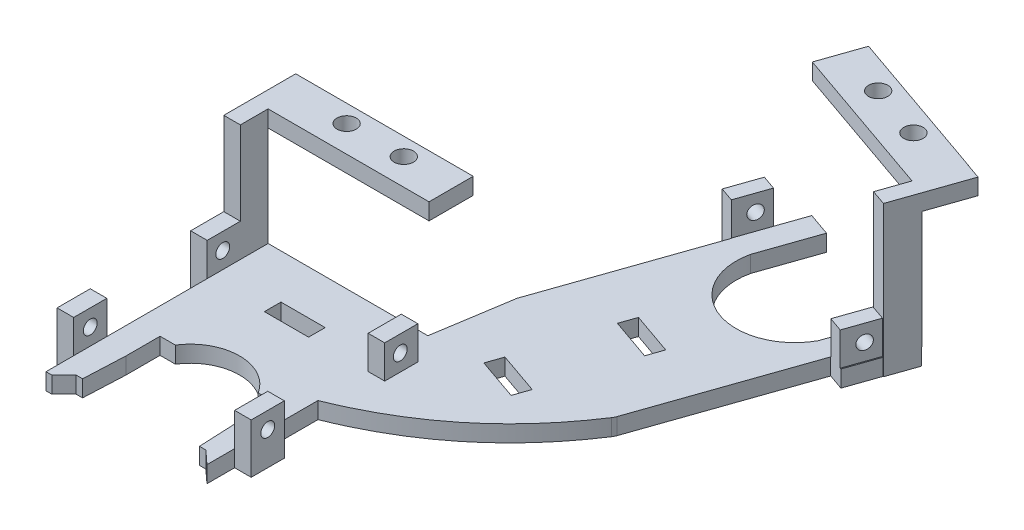
from build123d import *

# Parameters (mm, degrees)
SKETCH1_W                 = 29.13
SKETCH1_H                 = 40.2
BOSS_EXTRUDE1_DEPTH       = 3
SKETCH3_W                 = 6
SKETCH3_H                 = 3
BOSS_EXTRUDE2_DEPTH       = 3
SKETCH4_W                 = 3
SKETCH4_H                 = 6
BOSS_EXTRUDE3_DEPTH       = 6
SKETCH6_W                 = 6
SKETCH6_H                 = 3
BOSS_EXTRUDE4_DEPTH       = 5
SKETCH7_W                 = 3.000000005
SKETCH7_H                 = 6
BOSS_EXTRUDE6_DEPTH       = 6
SKETCH11_W                = 6
SKETCH11_H                = 3
BOSS_EXTRUDE7_DEPTH       = 3
SKETCH19_W                = 3
SKETCH19_H                = 6
BOSS_EXTRUDE11_DEPTH      = 6
SKETCH21_W                = 6
SKETCH21_H                = 3
BOSS_EXTRUDE12_DEPTH      = 3
SKETCH22_W                = 3
SKETCH22_H                = 6
BOSS_EXTRUDE13_DEPTH      = 6
CUT_EXTRUDE11_DEPTH       = 4
SKETCH30_W                = 25.92
SKETCH30_H                = 3
CUT_EXTRUDE12_DEPTH       = 15
SKETCH33_W                = 29.17650364
SKETCH33_H                = 3
BOSS_EXTRUDE14_DEPTH      = 40.3
SKETCH34_W                = 21.00258235
SKETCH34_H                = 3
CUT_EXTRUDE15_DEPTH       = 25
CUT_EXTRUDE16_DEPTH       = 5
SKETCH37_W                = 4.5
SKETCH37_H                = 3
SKETCH37_W_2              = 1.5
BOSS_EXTRUDE15_DEPTH      = 3
BOSS_EXTRUDE16_DEPTH      = 6
SKETCH41_W                = 6
SKETCH41_H                = 3
BOSS_EXTRUDE17_DEPTH      = 3
BOSS_EXTRUDE18_DEPTH      = 6
SKETCH46_W                = 5.02
SKETCH46_H                = 3
BOSS_EXTRUDE19_DEPTH      = 3
SKETCH48_W                = 3
SKETCH48_H                = 5.02
BOSS_EXTRUDE20_DEPTH      = 21.1
BOSS_EXTRUDE22_DEPTH      = 29.13
BOSS_EXTRUDE22_DEPTH_BACK = 3
SKETCH50_W                = 8
SKETCH50_H                = 3
SKETCH51_R                = 1.75
CUT_EXTRUDE21_DEPTH       = 5
SKETCH56_W                = 3.994197227
SKETCH56_H                = 3.994197227
CUT_EXTRUDE26_DEPTH       = 0.1
FILLET4_START             = -19
FILLET4_DEPTH             = 5
BOSS_EXTRUDE28_DEPTH      = 0.21
BOSS_EXTRUDE29_DEPTH      = 3
BOSS_EXTRUDE30_DEPTH      = 1.95
BOSS_EXTRUDE30_DEPTH_BACK = 4
SKETCH68_W                = 4.32399603
SKETCH68_H                = 3
SKETCH69_W                = 3.919724064
SKETCH69_H                = 3
BOSS_EXTRUDE31_DEPTH      = 1.83
SKETCH70_W                = 5.44243662
SKETCH70_H                = 3
BOSS_EXTRUDE32_DEPTH      = 3.1
BOSS_EXTRUDE33_DEPTH      = 24.17
SKETCH72_W                = 2.9
SKETCH72_H                = 2.93342148
BOSS_EXTRUDE34_DEPTH      = 8
SKETCH73_W                = 8
SKETCH73_H                = 2.93342148
BOSS_EXTRUDE35_DEPTH      = 29.3
SKETCH74_R                = 1.749999995
CUT_EXTRUDE27_DEPTH       = 5
CUT_EXTRUDE28_DEPTH       = 5
CUT_EXTRUDE28_DEPTH_BACK  = 5
SKETCH75_R                = 1.25
SKETCH75_R_2              = 1.249999999
CUT_EXTRUDE29_DEPTH       = 5
CUT_EXTRUDE29_DEPTH_BACK  = 5
SKETCH76_R                = 1.25
SKETCH77_R                = 1.25
CUT_EXTRUDE30_DEPTH       = 5
SKETCH78_R                = 1.25
CUT_EXTRUDE31_DEPTH       = 5
BOSS_EXTRUDE36_DEPTH      = 3
BOSS_EXTRUDE38_DEPTH      = 3
CUT_EXTRUDE32_DEPTH       = 10
CUT_EXTRUDE33_DEPTH       = 10
CUT_EXTRUDE34_DEPTH       = 10


with BuildPart() as part:
    # Sketch1 → Boss-Extrude1 (new body)
    with BuildSketch(Plane(origin=(0, 0, 0), x_dir=(1, 0, 0), z_dir=(0, 1, 0))):
        with Locations((-32.231128585, -983.966354464)):
            Rectangle(SKETCH1_W, SKETCH1_H)
        with BuildLine():
            Line((-15.507778999, -950.239071497), (-17.666128585, -963.866354464))
            Line((-17.666128585, -963.866354464), (-17.666128585, -983.966354464))
            add(Edge.make_bspline(
                [(11.825950039, -959.709415703), (1.028086592, -976.494542347), (-17.666128585, -983.966354464)],
                knots=[0, 0, 0, 1, 1, 1], degree=2))
            Line((11.825950039, -959.709415703), (-15.497121464, -950.208422428))
            Line((-15.497121464, -950.208422428), (-15.507778999, -950.239071497))
        make_face()
    extrude(amount=-BOSS_EXTRUDE1_DEPTH)

    # Sketch3 → Boss-Extrude2 (add)
    with BuildSketch(Plane.ZY.offset(46.796128585)):
        with Locations((971.886354464, -1.5)):
            Rectangle(SKETCH3_W, SKETCH3_H)
    extrude(amount=BOSS_EXTRUDE2_DEPTH)

    # Sketch4 → Boss-Extrude3 (add)
    with BuildSketch(Plane.XZ.offset(3)):
        with Locations((-48.296128585, 971.886354464)):
            Rectangle(SKETCH4_W, SKETCH4_H)
    extrude(amount=BOSS_EXTRUDE3_DEPTH)

    # Sketch6 → Boss-Extrude4 (add)
    with BuildSketch(Plane(origin=(-17.666128585, 0, 0), x_dir=(0, 0, -1), z_dir=(1, 0, 0))):
        with Locations((-971.886354464, -1.5)):
            Rectangle(SKETCH6_W, SKETCH6_H)
    extrude(amount=BOSS_EXTRUDE4_DEPTH)

    # Sketch7 → Boss-Extrude6 (add)
    with BuildSketch(Plane.XZ.offset(3)):
        with Locations((-16.166128583, 971.886354464)):
            Rectangle(SKETCH7_W, SKETCH7_H)
    extrude(amount=BOSS_EXTRUDE6_DEPTH)

    # Sketch11 → Boss-Extrude7 (add)
    with BuildSketch(Plane.ZY.offset(46.796128585)):
        with Locations((996.056354464, -1.5)):
            Rectangle(SKETCH11_W, SKETCH11_H)
    extrude(amount=BOSS_EXTRUDE7_DEPTH)

    # Sketch19 → Boss-Extrude11 (add)
    with BuildSketch(Plane.XZ.offset(3)):
        with Locations((-48.296128585, 996.056354464)):
            Rectangle(SKETCH19_W, SKETCH19_H)
    extrude(amount=BOSS_EXTRUDE11_DEPTH)

    # Sketch21 → Boss-Extrude12 (add)
    with BuildSketch(Plane(origin=(-17.666128585, 0, 0), x_dir=(0, 0, -1), z_dir=(1, 0, 0))):
        with Locations((-996.056354464, -1.5)):
            Rectangle(SKETCH21_W, SKETCH21_H)
    extrude(amount=BOSS_EXTRUDE12_DEPTH)

    # Sketch22 → Boss-Extrude13 (add)
    with BuildSketch(Plane.XZ.offset(3)):
        with Locations((-16.166128585, 996.056354464)):
            Rectangle(SKETCH22_W, SKETCH22_H)
    extrude(amount=BOSS_EXTRUDE13_DEPTH)

    # Sketch29 → Cut-Extrude11 (cut)
    with BuildSketch(Plane(origin=(0, 0, 0), x_dir=(1, 0, 0), z_dir=(0, 1, 0))):
        Polygon((-39.266128585, -988.183184315), (-42.032837695, -988.183184315), (-42.032837695, -994.347976596), (-42.376382193, -1001.868057312), (-43.532474114, -1001.868057312), (-45.730771266, -1004.066354464), (-39.266128585, -1004.066354464), align=None)
        Polygon((-24.371913352, -988.183184315), (-24.371913352, -1004.066354464), (-24.326128585, -1004.066354464), (-17.666128585, -1004.066354464), (-20.056128585, -1001.868057312), (-21.216128585, -1001.868057312), (-21.426128585, -997.305136389), (-21.556128585, -994.347976596), (-21.556128585, -988.183184315), align=None)
    extrude(amount=-CUT_EXTRUDE11_DEPTH, mode=Mode.SUBTRACT)

    # Sketch30 → Cut-Extrude12 (cut)
    with BuildSketch(Plane.ZY.offset(39.266128585)):
        with Locations((991.106354464, -1.5)):
            Rectangle(SKETCH30_W, SKETCH30_H)
    extrude(amount=-CUT_EXTRUDE12_DEPTH, mode=Mode.SUBTRACT)

    # Sketch33 → Boss-Extrude14 (add)
    with BuildSketch(Plane(origin=(-296.443416752, 0, 852.515567448), x_dir=(-0.9445255798324886, 0, -0.32843786176703366), z_dir=(0.3284378617670337, 0, -0.9445255798324887))):
        with Locations((-311.77524668, -1.5)):
            Rectangle(SKETCH33_W, SKETCH33_H)
    extrude(amount=BOSS_EXTRUDE14_DEPTH)

    # Sketch34 → Cut-Extrude15 (cut)
    with BuildSketch(Plane(origin=(-283.207370923, 0, 814.451186581), x_dir=(-0.9445255798324887, 0, -0.32843786176703327), z_dir=(0.32843786176703327, 0, -0.9445255798324887))):
        with Locations((-311.942483261, -1.5)):
            Rectangle(SKETCH34_W, SKETCH34_H)
    extrude(amount=-CUT_EXTRUDE15_DEPTH, mode=Mode.SUBTRACT)

    # Sketch35 → Cut-Extrude16 (cut)
    with BuildSketch(Plane(origin=(0, 0, 0), x_dir=(1, 0, 0), z_dir=(0, 1, 0))):
        Polygon((-6.699400727, -937.069026653), (11.67040627, -948.187810964), (13.138075545, -943.967069892), align=None)
    extrude(amount=-CUT_EXTRUDE16_DEPTH, mode=Mode.SUBTRACT)

    # Sketch37 → Boss-Extrude15 (add)
    with BuildSketch(Plane(origin=(280.946295288, 0, 97.69285498), x_dir=(-0.32843786176743117, 0, 0.9445255798323505), z_dir=(-0.9445255798323505, 0, -0.32843786176743117))):
        with Locations((868.136002588, -1.5)):
            Rectangle(SKETCH37_W, SKETCH37_H)
        with Locations((871.136002588, -1.5)):
            Rectangle(SKETCH37_W_2, SKETCH37_H)
    extrude(amount=BOSS_EXTRUDE15_DEPTH)

    # Sketch39 → Boss-Extrude16 (add)
    with BuildSketch(Plane.XZ.offset(3)):
        Polygon((-6.277028676, 914.559020058), (-3.745700122, 915.439233528), (-5.716327292, 921.106387007), (-8.247655846, 920.226173537), align=None)
    extrude(amount=BOSS_EXTRUDE16_DEPTH)

    # Sketch41 → Boss-Extrude17 (add)
    with BuildSketch(Plane(origin=(308.258672657, 0, 107.190129606), x_dir=(0.3284378617670337, 0, -0.9445255798324887), z_dir=(0.9445255798324887, 0, 0.3284378617670337))):
        with Locations((-868.898439213, -1.5)):
            Rectangle(SKETCH41_W, SKETCH41_H)
    extrude(amount=BOSS_EXTRUDE17_DEPTH)

    # Sketch42 → Boss-Extrude18 (add)
    with BuildSketch(Plane.XZ.offset(3)):
        Polygon((23.893176542, 925.063208116), (21.922549371, 930.730361595), (24.538885227, 931.640134472), (26.509512398, 925.972980993), align=None)
    extrude(amount=BOSS_EXTRUDE18_DEPTH)


with BuildPart() as body_2:
    # Mirror1: mirrored copy
    add(part.part.mirror(Plane(origin=(0, -9, 0), x_dir=(0, 0, 1), z_dir=(0, -1, 0))))

    # Sketch46 → Boss-Extrude19 (add)
    with BuildSketch(Plane.ZY.offset(46.796128585)):
        with Locations((966.376354464, -16.5)):
            Rectangle(SKETCH46_W, SKETCH46_H)
    extrude(amount=BOSS_EXTRUDE19_DEPTH)

    # Sketch48 → Boss-Extrude20 (add)
    with BuildSketch(Plane(origin=(0, -15, 0), x_dir=(1, 0, 0), z_dir=(0, 1, 0))):
        with Locations((-48.296128585, -966.376354464)):
            Rectangle(SKETCH48_W, SKETCH48_H)
    extrude(amount=BOSS_EXTRUDE20_DEPTH)

    # Sketch50 → Boss-Extrude22 (add, two sides: drawn at the far end of the back side and taken through both)
    with BuildSketch(Plane(origin=(-46.796128585, 0, 0), x_dir=(0, 0, -1), z_dir=(1, 0, 0)).offset(-BOSS_EXTRUDE22_DEPTH_BACK)):
        with Locations((-959.866354464, 4.6)):
            Rectangle(SKETCH50_W, SKETCH50_H)
    extrude(amount=BOSS_EXTRUDE22_DEPTH + BOSS_EXTRUDE22_DEPTH_BACK)

    # Sketch51 → Cut-Extrude21 (cut)
    with BuildSketch(Plane(origin=(0, 6.1, 0), x_dir=(1, 0, 0), z_dir=(0, 1, 0))):
        with Locations(Location((-37.381683329, -959.069638856, 0), (0, 0, 270))):
            Circle(SKETCH51_R)
        with Locations(Location((-27.031683329, -959.069638856, 0), (0, 0, 270))):
            Circle(SKETCH51_R)
    extrude(amount=-CUT_EXTRUDE21_DEPTH, mode=Mode.SUBTRACT)

    # Sketch56 → Cut-Extrude26 (cut)
    with BuildSketch(Plane(origin=(-283.207370923, 0, 814.451186581), x_dir=(-0.9445255798324892, 0, -0.32843786176703227), z_dir=(0.32843786176703227, 0, -0.9445255798324892))):
        with Locations((-299.444093473, -16.997098614)):
            Rectangle(SKETCH56_W, SKETCH56_H)
    extrude(amount=-CUT_EXTRUDE26_DEPTH, mode=Mode.SUBTRACT)

    # Fillet4: read off the stored shape, not the designer's step
    # Fillet4 outline → Fillet4 (cut)
    with BuildSketch(Plane(origin=(0, 0, 0), x_dir=(1, 0, 0), z_dir=(0, 1, 0)).offset(FILLET4_START)):
        with BuildLine():
            Line((11.815255904, -959.705697054), (11.918892326, -959.407658179))
            ThreePointArc((11.918892326, -959.407658179), (11.77847749, -959.744040081), (11.598302874, -960.060909482))
            add(Edge.make_bspline(
                [(11.825950039, -959.709415703), (11.712561825, -959.885676085), (11.598302874, -960.060909482)],
                knots=[0, 0, 0, 0.010500986, 0.010500986, 0.010500986], degree=2))
            Line((11.825950039, -959.709415703), (11.815255904, -959.705697054))
        make_face()
    extrude(amount=FILLET4_DEPTH, mode=Mode.SUBTRACT)


with BuildPart() as body_2_2:
    # Mirror2: mirrored copy
    add(body_2.part.mirror(Plane(origin=(-13.851466716, -18, 962.430133816), x_dir=(0, 0, 1), z_dir=(0, -1, 0))))

    # Sketch63 → Boss-Extrude28 (add)
    with BuildSketch(Plane(origin=(131.691734271, 0, 20.857921628), x_dir=(-0.15643446504022615, 0, 0.9876883405951385), z_dir=(-0.9876883405951385, 0, -0.15643446504022615))):
        with BuildLine():
            add(Edge.make_bspline(
                [(954.763151571, -21), (947.864577189, -21), (940.966002807, -21)],
                knots=[0, 0, 0, 1, 1, 1], degree=2))
            Line((940.966002807, -21), (940.966002807, -18))
            add(Edge.make_bspline(
                [(954.763151571, -18), (947.864577189, -18), (940.966002807, -18)],
                knots=[0, 0, 0, 1, 1, 1], degree=2))
            Line((954.763151571, -18), (954.763151571, -21))
        make_face()
    extrude(amount=BOSS_EXTRUDE28_DEPTH)

    # Sketch67 → Boss-Extrude29 (add)
    with BuildSketch(Plane(origin=(0, -18, 0), x_dir=(1, 0, 0), z_dir=(0, 1, 0))):
        Polygon((-15.715193551, -950.206220259), (-15.742698114, -950.123028585), (-15.497121464, -950.208422428), (-15.507778999, -950.239071497), align=None)
    extrude(amount=-BOSS_EXTRUDE29_DEPTH)

    # Sketch68 → Boss-Extrude30 (add, two sides: drawn at the far end of the back side and taken through both)
    with BuildSketch(Plane(origin=(-283.240214709, 0, 814.545639139), x_dir=(-0.9445255798324883, -3.1744861168227707e-15, -0.32843786176703493), z_dir=(0.32843786176703493, -9.129225613729643e-15, -0.9445255798324883)).offset(-BOSS_EXTRUDE30_DEPTH_BACK)):
        with Locations((-299.279194071, -19.5)):
            Rectangle(SKETCH68_W, SKETCH68_H)
    extrude(amount=BOSS_EXTRUDE30_DEPTH + BOSS_EXTRUDE30_DEPTH_BACK)

    # Sketch69 → Boss-Extrude31 (add)
    with BuildSketch(Plane(origin=(-283.207370923, 0, 814.451186581), x_dir=(-0.9445255798324895, 0, -0.32843786176703144), z_dir=(0.32843786176703144, 0, -0.9445255798324895))):
        with Locations((-324.403636468, -19.5)):
            Rectangle(SKETCH69_W, SKETCH69_H)
    extrude(amount=BOSS_EXTRUDE31_DEPTH)

    # Sketch70 → Boss-Extrude32 (add)
    with BuildSketch(Plane(origin=(308.258672657, 0, 107.190129606), x_dir=(0.3284378617670337, 0, -0.9445255798324887), z_dir=(0.9445255798324887, 0, 0.3284378617670337))):
        with Locations((-863.177220903, -19.5)):
            Rectangle(SKETCH70_W, SKETCH70_H)
    extrude(amount=BOSS_EXTRUDE32_DEPTH)

    # Sketch71 → Boss-Extrude33 (add)
    with BuildSketch(Plane.XZ.offset(21)):
        Polygon((28.589002033, 920.906174309), (26.792870072, 926.071512351), (24.05374589, 925.119042552), (25.841248137, 919.978521948), align=None)
    extrude(amount=BOSS_EXTRUDE33_DEPTH)

    # Sketch72 → Boss-Extrude34 (add)
    with BuildSketch(Plane(origin=(-282.606329636, 0, 812.722704769), x_dir=(-0.9445255798324861, 0, -0.3284378617670412), z_dir=(0.3284378617670412, 0, -0.9445255798324861))):
        with Locations((-328.0134985, -43.70328926)):
            Rectangle(SKETCH72_W, SKETCH72_H)
    extrude(amount=BOSS_EXTRUDE34_DEPTH)

    # Sketch73 → Boss-Extrude35 (add)
    with BuildSketch(Plane(origin=(308.447577773, 0, 107.255817179), x_dir=(-0.32843786176701534, 0, 0.9445255798324951), z_dir=(-0.9445255798324951, 0, -0.32843786176701534))):
        with Locations((856.429727564, -43.70328926)):
            Rectangle(SKETCH73_W, SKETCH73_H)
    extrude(amount=BOSS_EXTRUDE35_DEPTH)

    # Sketch74 → Cut-Extrude27 (cut)
    with BuildSketch(Plane.XZ.offset(45.17)):
        with Locations(Location((18.439626133, 912.298073036, 0), (0, 0, 270))):
            Circle(SKETCH74_R)
        with Locations(Location((8.663786379, 908.898741176, 0), (0, 0, 270))):
            Circle(SKETCH74_R)
    extrude(amount=-CUT_EXTRUDE27_DEPTH, mode=Mode.SUBTRACT)


with BuildPart() as body_2_3:
    # Mirror3: read off the stored shape, not the designer's step
    # Mirror3: mirrored copy
    add(body_2_2.part.mirror(Plane(origin=(0, -42.1, 0), x_dir=(1, 0, 0), z_dir=(0, 1, 0))))


with BuildPart() as body_2_4:
    # Mirror4: read off the stored shape, not the designer's step
    # Mirror4: mirrored copy
    add(body_2_3.part.mirror(Plane(origin=(0, -42.1, 0), x_dir=(1, 0, 0), z_dir=(0, 1, 0))))


with BuildPart() as body_2_5:
    # Mirror5: read off the stored shape, not the designer's step
    # Mirror5: mirrored copy
    add(body_2_4.part.mirror(Plane(origin=(0, -42.1, 0), x_dir=(1, 0, 0), z_dir=(0, 1, 0))))

    # Sketch75 → Cut-Extrude28 (cut, two sides: drawn at the far end of the back side and taken through both)
    with BuildSketch(Plane.ZY.offset(49.796128585).offset(-CUT_EXTRUDE28_DEPTH_BACK)):
        with Locations(Location((996.061659537, -60.2, 0), (0, 0, 180))):
            Circle(SKETCH75_R)
        with Locations(Location((972.069638843, -60.199999995, 0), (0, 0, 180))):
            Circle(SKETCH75_R_2)
    extrude(amount=CUT_EXTRUDE28_DEPTH + CUT_EXTRUDE28_DEPTH_BACK, mode=Mode.SUBTRACT)

    # Sketch76 → Cut-Extrude29 (cut, two sides: drawn at the far end of the back side and taken through both)
    with BuildSketch(Plane(origin=(-14.66612858, 0, 0), x_dir=(0, 0, -1), z_dir=(1, 0, 0)).offset(-CUT_EXTRUDE29_DEPTH_BACK)):
        with Locations(Location((-972.069638843, -60.2, 0), (0, 0, 2.32e-07))):
            Circle(SKETCH76_R)
        with Locations((-996.061659537, -60.2)):
            Circle(SKETCH76_R)
    extrude(amount=CUT_EXTRUDE29_DEPTH + CUT_EXTRUDE29_DEPTH_BACK, mode=Mode.SUBTRACT)

    # Sketch77 → Cut-Extrude30 (cut)
    with BuildSketch(Plane(origin=(311.092249396, 0, 108.175443191), x_dir=(0.32843786176703343, 0, -0.9445255798324887), z_dir=(0.9445255798324889, 0, 0.3284378617670335))):
        with Locations((-868.440574332, -60.2)):
            Circle(SKETCH77_R)
    extrude(amount=-CUT_EXTRUDE30_DEPTH, mode=Mode.SUBTRACT)

    # Sketch78 → Cut-Extrude31 (cut)
    with BuildSketch(Plane(origin=(278.112718549, 0, 96.707541395), x_dir=(-0.32843786176743106, 0, 0.9445255798323505), z_dir=(-0.9445255798323505, 0, -0.32843786176743106))):
        with Locations(Location((868.440574361, -60.2, 0), (0, 0, 180))):
            Circle(SKETCH78_R)
    extrude(amount=-CUT_EXTRUDE31_DEPTH, mode=Mode.SUBTRACT)

    # Sketch79 → Boss-Extrude36 (add)
    with BuildSketch(Plane.XZ.offset(66.2)):
        with BuildLine():
            Line((-24.266128585, 978.146354464), (-24.266128585, 988.183184315))
            ThreePointArc((-24.266128585, 988.183184315), (-31.766128585, 984.063765137), (-39.266128585, 988.183184315))
            Line((-39.266128585, 988.183184315), (-39.266128585, 978.146354464))
            Line((-39.266128585, 978.146354464), (-24.266128585, 978.146354464))
        make_face()
    extrude(amount=-BOSS_EXTRUDE36_DEPTH)

    # Sketch81 → Boss-Extrude38 (add)
    with BuildSketch(Plane(origin=(0, -63.2, 0), x_dir=(1, 0, 0), z_dir=(0, 1, 0))):
        with BuildLine():
            Line((11.67040627, -948.187810964), (18.227834043, -929.329880771))
            ThreePointArc((18.227834043, -929.329880771), (5.15828141, -934.170581208), (-1.418744216, -921.882850715))
            Line((-1.418744216, -921.882850715), (-6.699400727, -937.069026653))
            Line((-6.699400727, -937.069026653), (11.67040627, -948.187810964))
        make_face()
    extrude(amount=-BOSS_EXTRUDE38_DEPTH)

    # Sketch82 → Cut-Extrude32 (cut)
    with BuildSketch(Plane.XZ.offset(66.2)):
        Polygon((-32.448883016, 974.886354464), (-36.448883016, 974.886354464), (-36.448883016, 971.886354464), (-28.448883016, 971.886354464), (-28.448883016, 974.886354464), align=None)
    extrude(amount=-CUT_EXTRUDE32_DEPTH, mode=Mode.SUBTRACT)

    # Sketch88 → Cut-Extrude33 (cut)
    with BuildSketch(Plane(origin=(0, -66.2, 0), x_dir=(-1, 0, 0), z_dir=(0, -1, 0))):
        Polygon((0.985313585, -965.693308303), (8.541518224, -963.065805409), (7.556204639, -960.232228669), (0, -962.859731564), align=None)
    extrude(amount=-CUT_EXTRUDE33_DEPTH, mode=Mode.SUBTRACT)

    # Sketch85 → Cut-Extrude34 (cut)
    with BuildSketch(Plane.XZ.offset(66.2)):
        Polygon((4.885275223, 947.396800093), (1.107172904, 946.083048646), (-2.670929416, 944.769297199), (-1.68561583, 941.935720459), (5.870588808, 944.563223353), align=None)
    extrude(amount=-CUT_EXTRUDE34_DEPTH, mode=Mode.SUBTRACT)


solid = body_2_5.part
